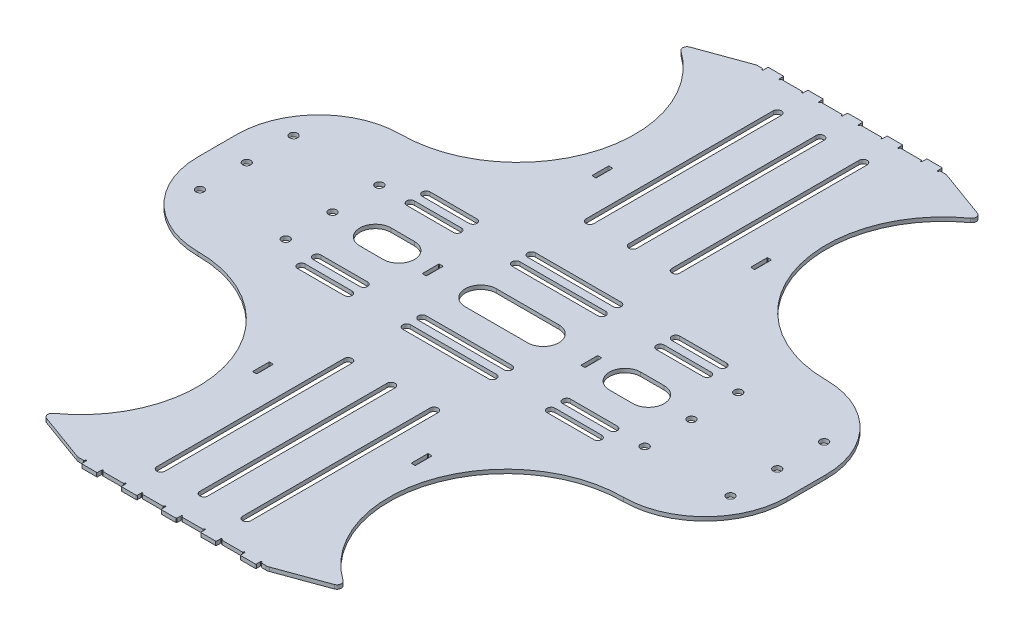
from build123d import *

# Parameters (mm, degrees)
SKETCH1_R                    = 3.2639
BASE_FLANGE1_DEPTH           = 3.175
SKETCH6_W                    = 12.7
SKETCH6_H                    = 3.175
WELDING_TABS_DEPTH           = 3.175
TAB_RELIEFS_DEPTH            = 369.197013983
FILLETS_FOR_CUTTER_R         = 0.508
SLOTS_FOR_GUSSET_WELDS_DEPTH = 369.197013983
MOUNTING_SLOTS_DEPTH         = 369.197013983


# Sheet-metal steps are written as plain solids
with BuildPart() as part:
    # Sketch1 → Base-Flange1 (new body)
    with BuildSketch(Plane(origin=(0, 0, 0), x_dir=(1, 0, 0), z_dir=(0, 1, 0))):
        with BuildLine():
            Line((76.107985452, 276.225), (-76.107985452, 276.225))
            ThreePointArc((-76.107985452, 276.225), (-77.21065138, 276.128529232), (-78.279813362, 275.842048142))
            Line((-78.279813362, 275.842048142), (-117.065626285, 261.725166726))
            ThreePointArc((-117.065626285, 261.725166726), (-119.392848666, 258.836078698), (-117.916919452, 255.432488446))
            ThreePointArc((-117.916919452, 255.432488446), (-82.366524362, 148.833916596), (-173.105317125, 82.55))
            ThreePointArc((-173.105317125, 82.55), (-220.251661761, 63.021344636), (-239.780317125, 15.875))
            Line((-239.780317125, 15.875), (-239.780317125, -15.875))
            ThreePointArc((-239.780317125, -15.875), (-220.251661761, -63.021344636), (-173.105317125, -82.55))
            ThreePointArc((-173.105317125, -82.55), (-82.366524362, -148.833916596), (-117.916919452, -255.432488446))
            ThreePointArc((-117.916919452, -255.432488446), (-119.392848666, -258.836078698), (-117.065626285, -261.725166726))
            Line((-117.065626285, -261.725166726), (-78.279813362, -275.842048142))
            ThreePointArc((-78.279813362, -275.842048142), (-77.21065138, -276.128529232), (-76.107985452, -276.225))
            Line((-76.107985452, -276.225), (76.107985452, -276.225))
            ThreePointArc((76.107985452, -276.225), (77.21065138, -276.128529232), (78.279813362, -275.842048142))
            Line((78.279813362, -275.842048142), (117.065626285, -261.725166726))
            ThreePointArc((117.065626285, -261.725166726), (119.392848666, -258.836078698), (117.916919452, -255.432488446))
            ThreePointArc((117.916919452, -255.432488446), (82.366524362, -148.833916596), (173.105317125, -82.55))
            ThreePointArc((173.105317125, -82.55), (220.251661761, -63.021344636), (239.780317125, -15.875))
            Line((239.780317125, -15.875), (239.780317125, 15.875))
            ThreePointArc((239.780317125, 15.875), (220.251661761, 63.021344636), (173.105317125, 82.55))
            ThreePointArc((173.105317125, 82.55), (82.366524362, 148.833916596), (117.916919452, 255.432488446))
            ThreePointArc((117.916919452, 255.432488446), (119.392848666, 258.836078698), (117.065626285, 261.725166726))
            Line((117.065626285, 261.725166726), (78.279813362, 275.842048142))
            ThreePointArc((78.279813362, 275.842048142), (77.21065138, 276.128529232), (76.107985452, 276.225))
        make_face()
        with Locations(Location((-215.9, 0, 0), (0, 0, 270))):
            Circle(SKETCH1_R, mode=Mode.SUBTRACT)
        with Locations(Location((-215.9, 38.1, 0), (0, 0, 270))):
            Circle(SKETCH1_R, mode=Mode.SUBTRACT)
        with Locations(Location((-215.9, -38.1, 0), (0, 0, 90))):
            Circle(SKETCH1_R, mode=Mode.SUBTRACT)
        with Locations(Location((215.9, -38.1, 0), (0, 0, 270))):
            Circle(SKETCH1_R, mode=Mode.SUBTRACT)
        with Locations(Location((215.9, 0, 0), (0, 0, 90))):
            Circle(SKETCH1_R, mode=Mode.SUBTRACT)
        with Locations(Location((215.9, 38.1, 0), (0, 0, 90))):
            Circle(SKETCH1_R, mode=Mode.SUBTRACT)
        with Locations(Location((-146.05, 0, 0), (0, 0, 270))):
            Circle(SKETCH1_R, mode=Mode.SUBTRACT)
        with Locations(Location((-146.05, 38.1, 0), (0, 0, 270))):
            Circle(SKETCH1_R, mode=Mode.SUBTRACT)
        with Locations(Location((-146.05, -38.1, 0), (0, 0, 90))):
            Circle(SKETCH1_R, mode=Mode.SUBTRACT)
        with Locations(Location((146.05, -38.1, 0), (0, 0, 270))):
            Circle(SKETCH1_R, mode=Mode.SUBTRACT)
        with Locations(Location((146.05, 38.1, 0), (0, 0, 90))):
            Circle(SKETCH1_R, mode=Mode.SUBTRACT)
        with Locations(Location((146.05, 0, 0), (0, 0, 90))):
            Circle(SKETCH1_R, mode=Mode.SUBTRACT)
    extrude(amount=-BASE_FLANGE1_DEPTH)

    # Sketch6 → Welding Tabs (add)
    with BuildSketch(Plane(origin=(0, 0, -276.225), x_dir=(-1, 0, 0), z_dir=(0, 0, -1))):
        with Locations((0, -1.5875)):
            Rectangle(SKETCH6_W, SKETCH6_H)
        with Locations((32.28975, -1.5875)):
            Rectangle(SKETCH6_W, SKETCH6_H)
        with Locations((64.5795, -1.5875)):
            Rectangle(SKETCH6_W, SKETCH6_H)
        with Locations((-64.5795, -1.5875)):
            Rectangle(SKETCH6_W, SKETCH6_H)
        with Locations((-32.28975, -1.5875)):
            Rectangle(SKETCH6_W, SKETCH6_H)
    welding_tabs = extrude(amount=WELDING_TABS_DEPTH)

    # Sketch7 → Tab Reliefs (cut, through all)
    with BuildSketch(Plane(origin=(0, 0, 0), x_dir=(1, 0, 0), z_dir=(0, 1, 0))):
        with BuildLine():
            Line((-71.9455, 276.225), (-71.9455, 275.59))
            ThreePointArc((-71.9455, 275.59), (-71.4375, 275.082), (-70.9295, 275.59))
            Line((-70.9295, 275.59), (-70.9295, 276.225))
            Line((-70.9295, 276.225), (-71.9455, 276.225))
        make_face()
        with BuildLine():
            Line((-57.2135, 276.225), (-58.2295, 276.225))
            Line((-58.2295, 276.225), (-58.2295, 275.59))
            ThreePointArc((-58.2295, 275.59), (-57.7215, 275.082), (-57.2135, 275.59))
            Line((-57.2135, 275.59), (-57.2135, 276.225))
        make_face()
        with BuildLine():
            Line((-39.65575, 276.225), (-39.65575, 275.59))
            ThreePointArc((-39.65575, 275.59), (-39.14775, 275.082), (-38.63975, 275.59))
            Line((-38.63975, 275.59), (-38.63975, 276.225))
            Line((-38.63975, 276.225), (-39.65575, 276.225))
        make_face()
        with BuildLine():
            Line((-24.92375, 276.225), (-25.93975, 276.225))
            Line((-25.93975, 276.225), (-25.93975, 275.59))
            ThreePointArc((-25.93975, 275.59), (-25.43175, 275.082), (-24.92375, 275.59))
            Line((-24.92375, 275.59), (-24.92375, 276.225))
        make_face()
        with BuildLine():
            Line((-7.366, 276.225), (-7.366, 275.59))
            ThreePointArc((-7.366, 275.59), (-6.858, 275.082), (-6.35, 275.59))
            Line((-6.35, 275.59), (-6.35, 276.225))
            Line((-6.35, 276.225), (-7.366, 276.225))
        make_face()
        with BuildLine():
            Line((7.366, 276.225), (6.35, 276.225))
            Line((6.35, 276.225), (6.35, 275.59))
            ThreePointArc((6.35, 275.59), (6.858, 275.082), (7.366, 275.59))
            Line((7.366, 275.59), (7.366, 276.225))
        make_face()
        with BuildLine():
            Line((24.92375, 276.225), (24.92375, 275.59))
            ThreePointArc((24.92375, 275.59), (25.43175, 275.082), (25.93975, 275.59))
            Line((25.93975, 275.59), (25.93975, 276.225))
            Line((25.93975, 276.225), (24.92375, 276.225))
        make_face()
        with BuildLine():
            Line((39.65575, 276.225), (38.63975, 276.225))
            Line((38.63975, 276.225), (38.63975, 275.59))
            ThreePointArc((38.63975, 275.59), (39.14775, 275.082), (39.65575, 275.59))
            Line((39.65575, 275.59), (39.65575, 276.225))
        make_face()
        with BuildLine():
            Line((57.2135, 276.225), (57.2135, 275.59))
            ThreePointArc((57.2135, 275.59), (57.7215, 275.082), (58.2295, 275.59))
            Line((58.2295, 275.59), (58.2295, 276.225))
            Line((58.2295, 276.225), (57.2135, 276.225))
        make_face()
        with BuildLine():
            Line((71.9455, 276.225), (70.9295, 276.225))
            Line((70.9295, 276.225), (70.9295, 275.59))
            ThreePointArc((70.9295, 275.59), (71.4375, 275.082), (71.9455, 275.59))
            Line((71.9455, 275.59), (71.9455, 276.225))
        make_face()
    tab_reliefs = extrude(amount=-TAB_RELIEFS_DEPTH, mode=Mode.SUBTRACT)

    # Mirror Tabs: Welding Tabs, Tab Reliefs across plane
    add(welding_tabs.mirror(Plane.XY))
    add(tab_reliefs.mirror(Plane.XY), mode=Mode.SUBTRACT)

    # Fillets for Cutter
    fillets_for_cutter_edges = [part.edges().sort_by_distance(p)[0] for p in [
        (-6.35, -1.5875, -279.4),
        (6.35, -1.5875, -279.4),
        (-38.63975, -1.5875, -279.4),
        (-25.93975, -1.5875, -279.4),
        (-70.9295, -1.5875, -279.4),
        (-58.2295, -1.5875, -279.4),
        (58.2295, -1.5875, -279.4),
        (70.9295, -1.5875, -279.4),
        (25.93975, -1.5875, -279.4),
        (38.63975, -1.5875, -279.4),
        (-57.2135, -1.5875, -276.225),
        (-39.65575, -1.5875, -276.225),
        (-24.92375, -1.5875, -276.225),
        (-7.366, -1.5875, -276.225),
        (7.366, -1.5875, -276.225),
        (24.92375, -1.5875, -276.225),
        (39.65575, -1.5875, -276.225),
        (57.2135, -1.5875, -276.225),
        (71.9455, -1.5875, -276.225),
        (-71.9455, -1.5875, -276.225),
        (-6.35, -1.5875, 279.4),
        (6.35, -1.5875, 279.4),
        (-38.63975, -1.5875, 279.4),
        (-25.93975, -1.5875, 279.4),
        (-70.9295, -1.5875, 279.4),
        (-58.2295, -1.5875, 279.4),
        (58.2295, -1.5875, 279.4),
        (70.9295, -1.5875, 279.4),
        (25.93975, -1.5875, 279.4),
        (38.63975, -1.5875, 279.4),
        (-57.2135, -1.5875, 276.225),
        (-39.65575, -1.5875, 276.225),
        (-24.92375, -1.5875, 276.225),
        (-7.366, -1.5875, 276.225),
        (7.366, -1.5875, 276.225),
        (24.92375, -1.5875, 276.225),
        (39.65575, -1.5875, 276.225),
        (57.2135, -1.5875, 276.225),
        (71.9455, -1.5875, 276.225),
        (-71.9455, -1.5875, 276.225),
    ]]
    fillet(fillets_for_cutter_edges, radius=FILLETS_FOR_CUTTER_R)

    # Sketch8 → Slots for Gusset Welds (cut, through all)
    with BuildSketch(Plane(origin=(0, 0, 0), x_dir=(1, 0, 0), z_dir=(0, 1, 0))):
        with BuildLine():
            Line((-65.7479, 6.858), (-63.4111, 6.858))
            ThreePointArc((-63.4111, 6.858), (-63.051889755, 6.709210245), (-62.9031, 6.35))
            Line((-62.9031, 6.35), (-62.9031, -6.35))
            ThreePointArc((-62.9031, -6.35), (-63.051889755, -6.709210245), (-63.4111, -6.858))
            Line((-63.4111, -6.858), (-65.7479, -6.858))
            ThreePointArc((-65.7479, -6.858), (-66.107110245, -6.709210245), (-66.2559, -6.35))
            Line((-66.2559, -6.35), (-66.2559, 6.35))
            ThreePointArc((-66.2559, 6.35), (-66.107110245, 6.709210245), (-65.7479, 6.858))
        make_face()
        with BuildLine():
            Line((-65.7479, 144.9705), (-63.4111, 144.9705))
            ThreePointArc((-63.4111, 144.9705), (-63.051889755, 144.821710245), (-62.9031, 144.4625))
            Line((-62.9031, 144.4625), (-62.9031, 131.7625))
            ThreePointArc((-62.9031, 131.7625), (-63.051889755, 131.403289755), (-63.4111, 131.2545))
            Line((-63.4111, 131.2545), (-65.7479, 131.2545))
            ThreePointArc((-65.7479, 131.2545), (-66.107110245, 131.403289755), (-66.2559, 131.7625))
            Line((-66.2559, 131.7625), (-66.2559, 144.4625))
            ThreePointArc((-66.2559, 144.4625), (-66.107110245, 144.821710245), (-65.7479, 144.9705))
        make_face()
        with BuildLine():
            Line((-65.7479, -131.2545), (-63.4111, -131.2545))
            ThreePointArc((-63.4111, -131.2545), (-63.051889755, -131.403289755), (-62.9031, -131.7625))
            Line((-62.9031, -131.7625), (-62.9031, -144.4625))
            ThreePointArc((-62.9031, -144.4625), (-63.051889755, -144.821710245), (-63.4111, -144.9705))
            Line((-63.4111, -144.9705), (-65.7479, -144.9705))
            ThreePointArc((-65.7479, -144.9705), (-66.107110245, -144.821710245), (-66.2559, -144.4625))
            Line((-66.2559, -144.4625), (-66.2559, -131.7625))
            ThreePointArc((-66.2559, -131.7625), (-66.107110245, -131.403289755), (-65.7479, -131.2545))
        make_face()
        with BuildLine():
            Line((62.9031, -131.7625), (62.9031, -144.4625))
            ThreePointArc((62.9031, -144.4625), (63.051889755, -144.821710245), (63.4111, -144.9705))
            Line((63.4111, -144.9705), (65.7479, -144.9705))
            ThreePointArc((65.7479, -144.9705), (66.107110245, -144.821710245), (66.2559, -144.4625))
            Line((66.2559, -144.4625), (66.2559, -131.7625))
            ThreePointArc((66.2559, -131.7625), (66.107110245, -131.403289755), (65.7479, -131.2545))
            Line((65.7479, -131.2545), (63.4111, -131.2545))
            ThreePointArc((63.4111, -131.2545), (63.051889755, -131.403289755), (62.9031, -131.7625))
        make_face()
        with BuildLine():
            Line((62.9031, 6.35), (62.9031, -6.35))
            ThreePointArc((62.9031, -6.35), (63.051889755, -6.709210245), (63.4111, -6.858))
            Line((63.4111, -6.858), (65.7479, -6.858))
            ThreePointArc((65.7479, -6.858), (66.107110245, -6.709210245), (66.2559, -6.35))
            Line((66.2559, -6.35), (66.2559, 6.35))
            ThreePointArc((66.2559, 6.35), (66.107110245, 6.709210245), (65.7479, 6.858))
            Line((65.7479, 6.858), (63.4111, 6.858))
            ThreePointArc((63.4111, 6.858), (63.051889755, 6.709210245), (62.9031, 6.35))
        make_face()
        with BuildLine():
            Line((62.9031, 144.4625), (62.9031, 131.7625))
            ThreePointArc((62.9031, 131.7625), (63.051889755, 131.403289755), (63.4111, 131.2545))
            Line((63.4111, 131.2545), (65.7479, 131.2545))
            ThreePointArc((65.7479, 131.2545), (66.107110245, 131.403289755), (66.2559, 131.7625))
            Line((66.2559, 131.7625), (66.2559, 144.4625))
            ThreePointArc((66.2559, 144.4625), (66.107110245, 144.821710245), (65.7479, 144.9705))
            Line((65.7479, 144.9705), (63.4111, 144.9705))
            ThreePointArc((63.4111, 144.9705), (63.051889755, 144.821710245), (62.9031, 144.4625))
        make_face()
    extrude(amount=-SLOTS_FOR_GUSSET_WELDS_DEPTH, mode=Mode.SUBTRACT)

    # Sketch9 → Mounting Slots (cut, through all)
    with BuildSketch(Plane(origin=(0, 0, 0), x_dir=(1, 0, 0), z_dir=(0, 1, 0))):
        with BuildLine():
            Line((3.2639, 250.825), (3.2639, 98.425))
            ThreePointArc((3.2639, 98.425), (0, 95.1611), (-3.2639, 98.425))
            Line((-3.2639, 98.425), (-3.2639, 250.825))
            ThreePointArc((-3.2639, 250.825), (0, 254.0889), (3.2639, 250.825))
        make_face()
        with BuildLine():
            Line((-31.6611, 250.825), (-31.6611, 98.425))
            ThreePointArc((-31.6611, 98.425), (-34.925, 95.1611), (-38.1889, 98.425))
            Line((-38.1889, 98.425), (-38.1889, 250.825))
            ThreePointArc((-38.1889, 250.825), (-34.925, 254.0889), (-31.6611, 250.825))
        make_face()
        with BuildLine():
            Line((31.6611, 250.825), (31.6611, 98.425))
            ThreePointArc((31.6611, 98.425), (34.925, 95.1611), (38.1889, 98.425))
            Line((38.1889, 98.425), (38.1889, 250.825))
            ThreePointArc((38.1889, 250.825), (34.925, 254.0889), (31.6611, 250.825))
        make_face()
        with BuildLine():
            Line((-31.6611, -250.825), (-31.6611, -98.425))
            ThreePointArc((-31.6611, -98.425), (-34.925, -95.1611), (-38.1889, -98.425))
            Line((-38.1889, -98.425), (-38.1889, -250.825))
            ThreePointArc((-38.1889, -250.825), (-34.925, -254.0889), (-31.6611, -250.825))
        make_face()
        with BuildLine():
            Line((3.2639, -250.825), (3.2639, -98.425))
            ThreePointArc((3.2639, -98.425), (0, -95.1611), (-3.2639, -98.425))
            Line((-3.2639, -98.425), (-3.2639, -250.825))
            ThreePointArc((-3.2639, -250.825), (0, -254.0889), (3.2639, -250.825))
        make_face()
        with BuildLine():
            Line((31.6611, -250.825), (31.6611, -98.425))
            ThreePointArc((31.6611, -98.425), (34.925, -95.1611), (38.1889, -98.425))
            Line((38.1889, -98.425), (38.1889, -250.825))
            ThreePointArc((38.1889, -250.825), (34.925, -254.0889), (31.6611, -250.825))
        make_face()
        with BuildLine():
            Line((-34.925, 53.975), (34.925, 53.975))
            ThreePointArc((34.925, 53.975), (38.1, 50.8), (34.925, 47.625))
            Line((34.925, 47.625), (-34.925, 47.625))
            ThreePointArc((-34.925, 47.625), (-38.1, 50.8), (-34.925, 53.975))
        make_face()
        with BuildLine():
            Line((-34.925, -53.975), (34.925, -53.975))
            ThreePointArc((34.925, -53.975), (38.1, -50.8), (34.925, -47.625))
            Line((34.925, -47.625), (-34.925, -47.625))
            ThreePointArc((-34.925, -47.625), (-38.1, -50.8), (-34.925, -53.975))
        make_face()
        with BuildLine():
            Line((-34.925, 41.275), (34.925, 41.275))
            ThreePointArc((34.925, 41.275), (38.1, 38.1), (34.925, 34.925))
            Line((34.925, 34.925), (-34.925, 34.925))
            ThreePointArc((-34.925, 34.925), (-38.1, 38.1), (-34.925, 41.275))
        make_face()
        with BuildLine():
            Line((-34.925, -41.275), (34.925, -41.275))
            ThreePointArc((34.925, -41.275), (38.1, -38.1), (34.925, -34.925))
            Line((34.925, -34.925), (-34.925, -34.925))
            ThreePointArc((-34.925, -34.925), (-38.1, -38.1), (-34.925, -41.275))
        make_face()
        with BuildLine():
            Line((-120.65, 53.975), (-82.55, 53.975))
            ThreePointArc((-82.55, 53.975), (-79.375, 50.8), (-82.55, 47.625))
            Line((-82.55, 47.625), (-120.65, 47.625))
            ThreePointArc((-120.65, 47.625), (-123.825, 50.8), (-120.65, 53.975))
        make_face()
        with BuildLine():
            Line((-120.65, 41.275), (-82.55, 41.275))
            ThreePointArc((-82.55, 41.275), (-79.375, 38.1), (-82.55, 34.925))
            Line((-82.55, 34.925), (-120.65, 34.925))
            ThreePointArc((-120.65, 34.925), (-123.825, 38.1), (-120.65, 41.275))
        make_face()
        with BuildLine():
            Line((120.65, 53.975), (82.55, 53.975))
            ThreePointArc((82.55, 53.975), (79.375, 50.8), (82.55, 47.625))
            Line((82.55, 47.625), (120.65, 47.625))
            ThreePointArc((120.65, 47.625), (123.825, 50.8), (120.65, 53.975))
        make_face()
        with BuildLine():
            Line((120.65, 41.275), (82.55, 41.275))
            ThreePointArc((82.55, 41.275), (79.375, 38.1), (82.55, 34.925))
            Line((82.55, 34.925), (120.65, 34.925))
            ThreePointArc((120.65, 34.925), (123.825, 38.1), (120.65, 41.275))
        make_face()
        with BuildLine():
            Line((-120.65, -53.975), (-82.55, -53.975))
            ThreePointArc((-82.55, -53.975), (-79.375, -50.8), (-82.55, -47.625))
            Line((-82.55, -47.625), (-120.65, -47.625))
            ThreePointArc((-120.65, -47.625), (-123.825, -50.8), (-120.65, -53.975))
        make_face()
        with BuildLine():
            Line((-120.65, -41.275), (-82.55, -41.275))
            ThreePointArc((-82.55, -41.275), (-79.375, -38.1), (-82.55, -34.925))
            Line((-82.55, -34.925), (-120.65, -34.925))
            ThreePointArc((-120.65, -34.925), (-123.825, -38.1), (-120.65, -41.275))
        make_face()
        with BuildLine():
            Line((120.65, -53.975), (82.55, -53.975))
            ThreePointArc((82.55, -53.975), (79.375, -50.8), (82.55, -47.625))
            Line((82.55, -47.625), (120.65, -47.625))
            ThreePointArc((120.65, -47.625), (123.825, -50.8), (120.65, -53.975))
        make_face()
        with BuildLine():
            Line((120.65, -41.275), (82.55, -41.275))
            ThreePointArc((82.55, -41.275), (79.375, -38.1), (82.55, -34.925))
            Line((82.55, -34.925), (120.65, -34.925))
            ThreePointArc((120.65, -34.925), (123.825, -38.1), (120.65, -41.275))
        make_face()
        with BuildLine():
            Line((-25.4, 12.7), (25.4, 12.7))
            ThreePointArc((25.4, 12.7), (38.1, 0), (25.4, -12.7))
            Line((25.4, -12.7), (-25.4, -12.7))
            ThreePointArc((-25.4, -12.7), (-38.1, 0), (-25.4, 12.7))
        make_face()
        with BuildLine():
            Line((92.075, 12.7), (111.125, 12.7))
            ThreePointArc((111.125, 12.7), (123.825, 0), (111.125, -12.7))
            Line((111.125, -12.7), (92.075, -12.7))
            ThreePointArc((92.075, -12.7), (79.375, 0), (92.075, 12.7))
        make_face()
        with BuildLine():
            Line((-92.075, 12.7), (-111.125, 12.7))
            ThreePointArc((-111.125, 12.7), (-123.825, 0), (-111.125, -12.7))
            Line((-111.125, -12.7), (-92.075, -12.7))
            ThreePointArc((-92.075, -12.7), (-79.375, 0), (-92.075, 12.7))
        make_face()
    extrude(amount=-MOUNTING_SLOTS_DEPTH, mode=Mode.SUBTRACT)


solid = part.part
